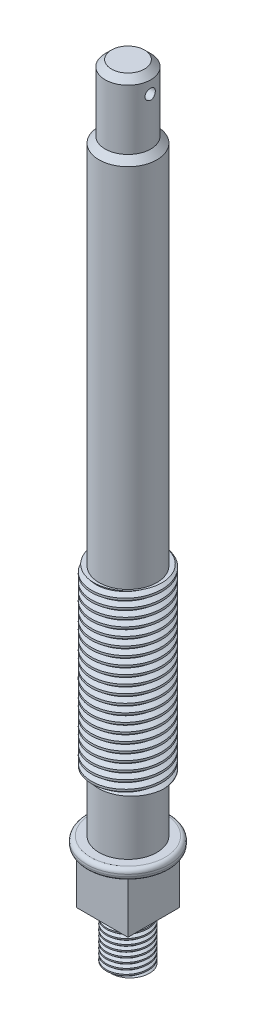
from build123d import *

# Parameters (mm, degrees)
SKETCH2_W               = 25
SKETCH2_H               = 25
BOSS_EXTRUDE1_DEPTH     = 25
THREAD1_PITCH           = 4
THREAD4_PITCH           = 2.5
CUT_EXTRUDE1_DEPTH      = 380.056724087
CUT_EXTRUDE1_DEPTH_BACK = 380.056724087
SKETCH26_R              = 2.5
FILLET1_R               = 2
CHAMFER1_SIZE           = 3


with BuildPart() as part:
    # Sketch1 → Revolve1 (revolve)
    with BuildSketch(Plane.XY, mode=Mode.PRIVATE) as revolve1_sk:
        Polygon((0, 0), (11, 0), (11, -32), (14, -32), (14, -212), (17, -212), (17, -297), (14, -297), (14, -325), (20, -325), (20, -330), (10, -330), (10, -378), (0, -378), align=None)
    revolve(revolve1_sk.sketch.rotate(Axis((0, -0.121355493, 0), (0, -1, 0)), 180), axis=Axis((0, -0.121355493, 0), (0, -1, 0)))

    # Sketch2 → Boss-Extrude1 (add)
    with BuildSketch(Plane.XZ.offset(330)):
        Rectangle(SKETCH2_W, SKETCH2_H)
    extrude(amount=BOSS_EXTRUDE1_DEPTH)

    # Thread1: arcs per turn and ends read off the stored shape
    # Thread1: the profile of Thread Profile1 profile screwed along a right-hand helix through 27.5 turns, 12 arcs to a turn; built about Z, then put on its axis
    thread1_z = Axis((0, 0, 0), (0, 0, 1))
    thread1_corners = [(17.0003, 0, -0.000173205), (14.8349365, 0, 1.249999995), (14.8349365, 0, 1.749999995), (17.0003, 0, 3.000173194)]
    with BuildLine(mode=Mode.PRIVATE) as thread1_profile:
        Line(thread1_corners[0], thread1_corners[1])
        Line(thread1_corners[1], thread1_corners[2])
        Line(thread1_corners[2], thread1_corners[3])
        Line(thread1_corners[3], thread1_corners[0])
    thread1_cap = Face(thread1_profile.wire())
    thread1_turn_angles = [0, 15, 30, 45, 60, 75, 90, 105, 120, 135, 150, 165, 180, 195, 210, 225, 240, 255, 270, 285, 300, 315, 330, 345, 360]
    thread1_turn_weights = [1, 0.9659258262890683, 1, 0.9659258262890683, 1, 0.9659258262890683, 1, 0.9659258262890683, 1, 0.9659258262890683, 1, 0.9659258262890683, 1, 0.9659258262890683, 1, 0.9659258262890683, 1, 0.9659258262890683, 1, 0.9659258262890683, 1, 0.9659258262890683, 1, 0.9659258262890683, 1]
    thread1_turn_rails = [Edge.make_bspline([Vector(p[0], p[1], 0).rotate(thread1_z, thread1_turn_angles[k]) / thread1_turn_weights[k] + Vector(0, 0, p[2] + THREAD1_PITCH * thread1_turn_angles[k] / 360) for k in range(25)], [0, 0, 0, 1, 1, 2, 2, 3, 3, 4, 4, 5, 5, 6, 6, 7, 7, 8, 8, 9, 9, 10, 10, 11, 11, 12, 12, 12], 2, thread1_turn_weights) for p in thread1_corners]
    thread1_turn_sides = [Face.make_surface_from_curves(thread1_turn_rails[p[0]], thread1_turn_rails[p[1]]) for p in [(0, 1), (1, 2), (2, 3), (3, 0)]]
    thread1_last_angles = [9720, 9735, 9750, 9765, 9780, 9795, 9810, 9825, 9840, 9855, 9870, 9885, 9900]
    thread1_last_weights = [1, 0.9659258262890683, 1, 0.9659258262890683, 1, 0.9659258262890683, 1, 0.9659258262890683, 1, 0.9659258262890683, 1, 0.9659258262890683, 1]
    thread1_last_rails = [Edge.make_bspline([Vector(p[0], p[1], 0).rotate(thread1_z, thread1_last_angles[k]) / thread1_last_weights[k] + Vector(0, 0, p[2] + THREAD1_PITCH * thread1_last_angles[k] / 360) for k in range(13)], [0, 0, 0, 1, 1, 2, 2, 3, 3, 4, 4, 5, 5, 6, 6, 6], 2, thread1_last_weights) for p in thread1_corners]
    thread1_last_sides = [Face.make_surface_from_curves(thread1_last_rails[p[0]], thread1_last_rails[p[1]]) for p in [(0, 1), (1, 2), (2, 3), (3, 0)]]
    thread1 = Plane(origin=(0, -301, 0), x_dir=(1, 0, 0), z_dir=(0, 1, 0)) * Solid(Shell([*[p.moved(Location((0, 0, THREAD1_PITCH * i))) for i in range(27) for p in thread1_turn_sides], *thread1_last_sides, thread1_cap, thread1_cap.rotate(thread1_z, 9900).moved(Location((0, 0, THREAD1_PITCH * 9900 / 360)))]))
    add(thread1, mode=Mode.SUBTRACT)

    # Thread4: arcs per turn and ends read off the stored shape
    # Thread4: the profile of Thread Profile6 profile screwed along a right-hand helix through 9.2 turns, 10 arcs to a turn; built about Z, then put on its axis
    thread4_z = Axis((0, 0, 0), (0, 0, 1))
    thread4_corners = [(10.0003, 0, -0.000173205), (8.646835312, 0, 0.781249997), (8.646835312, 0, 1.093749997), (10.0003, 0, 1.875173198)]
    with BuildLine(mode=Mode.PRIVATE) as thread4_profile:
        Line(thread4_corners[0], thread4_corners[1])
        Line(thread4_corners[1], thread4_corners[2])
        Line(thread4_corners[2], thread4_corners[3])
        Line(thread4_corners[3], thread4_corners[0])
    thread4_cap = Face(thread4_profile.wire())
    thread4_turn_angles = [0, 18, 36, 54, 72, 90, 108, 126, 144, 162, 180, 198, 216, 234, 252, 270, 288, 306, 324, 342, 360]
    thread4_turn_weights = [1, 0.9510565162951535, 1, 0.9510565162951535, 1, 0.9510565162951535, 1, 0.9510565162951535, 1, 0.9510565162951535, 1, 0.9510565162951535, 1, 0.9510565162951535, 1, 0.9510565162951535, 1, 0.9510565162951535, 1, 0.9510565162951535, 1]
    thread4_turn_rails = [Edge.make_bspline([Vector(p[0], p[1], 0).rotate(thread4_z, thread4_turn_angles[k]) / thread4_turn_weights[k] + Vector(0, 0, p[2] + THREAD4_PITCH * thread4_turn_angles[k] / 360) for k in range(21)], [0, 0, 0, 1, 1, 2, 2, 3, 3, 4, 4, 5, 5, 6, 6, 7, 7, 8, 8, 9, 9, 10, 10, 10], 2, thread4_turn_weights) for p in thread4_corners]
    thread4_turn_sides = [Face.make_surface_from_curves(thread4_turn_rails[p[0]], thread4_turn_rails[p[1]]) for p in [(0, 1), (1, 2), (2, 3), (3, 0)]]
    thread4_last_angles = [3240, 3258, 3276, 3294, 3312]
    thread4_last_weights = [1, 0.9510565162951535, 1, 0.9510565162952099, 1]
    thread4_last_rails = [Edge.make_bspline([Vector(p[0], p[1], 0).rotate(thread4_z, thread4_last_angles[k]) / thread4_last_weights[k] + Vector(0, 0, p[2] + THREAD4_PITCH * thread4_last_angles[k] / 360) for k in range(5)], [0, 0, 0, 1, 1, 2, 2, 2], 2, thread4_last_weights) for p in thread4_corners]
    thread4_last_sides = [Face.make_surface_from_curves(thread4_last_rails[p[0]], thread4_last_rails[p[1]]) for p in [(0, 1), (1, 2), (2, 3), (3, 0)]]
    thread4 = Plane(origin=(0, -355, 0), x_dir=(-1, 0, 0), z_dir=(0, -1, 0)) * Solid(Shell([*[p.moved(Location((0, 0, THREAD4_PITCH * i))) for i in range(9) for p in thread4_turn_sides], *thread4_last_sides, thread4_cap, thread4_cap.rotate(thread4_z, 3312).moved(Location((0, 0, THREAD4_PITCH * 3312 / 360)))]))
    add(thread4, mode=Mode.SUBTRACT)

    # Sketch26 → Cut-Extrude1 (cut, two sides: drawn at the far end of the back side and taken through both)
    with BuildSketch(Plane(origin=(0, 0, 0), x_dir=(0, 0, -1), z_dir=(1, 0, 0)).offset(-CUT_EXTRUDE1_DEPTH_BACK)):
        with Locations((0, -9)):
            Circle(SKETCH26_R)
    extrude(amount=CUT_EXTRUDE1_DEPTH + CUT_EXTRUDE1_DEPTH_BACK, mode=Mode.SUBTRACT)

    # Fillet1
    fillet1_edges = [part.edges().sort_by_distance(p)[0] for p in [
        (20, -330, 0),
        (20, -325, 0),
    ]]
    fillet(fillet1_edges, radius=FILLET1_R)

    # Chamfer1
    chamfer1_edges = [part.edges().sort_by_distance(p)[0] for p in [
        (14, -32, 0),
        (11, 0, 0),
    ]]
    chamfer(chamfer1_edges, length=CHAMFER1_SIZE - 0.0001)  # a hair under: the kernel refuses the full size


solid = part.part
